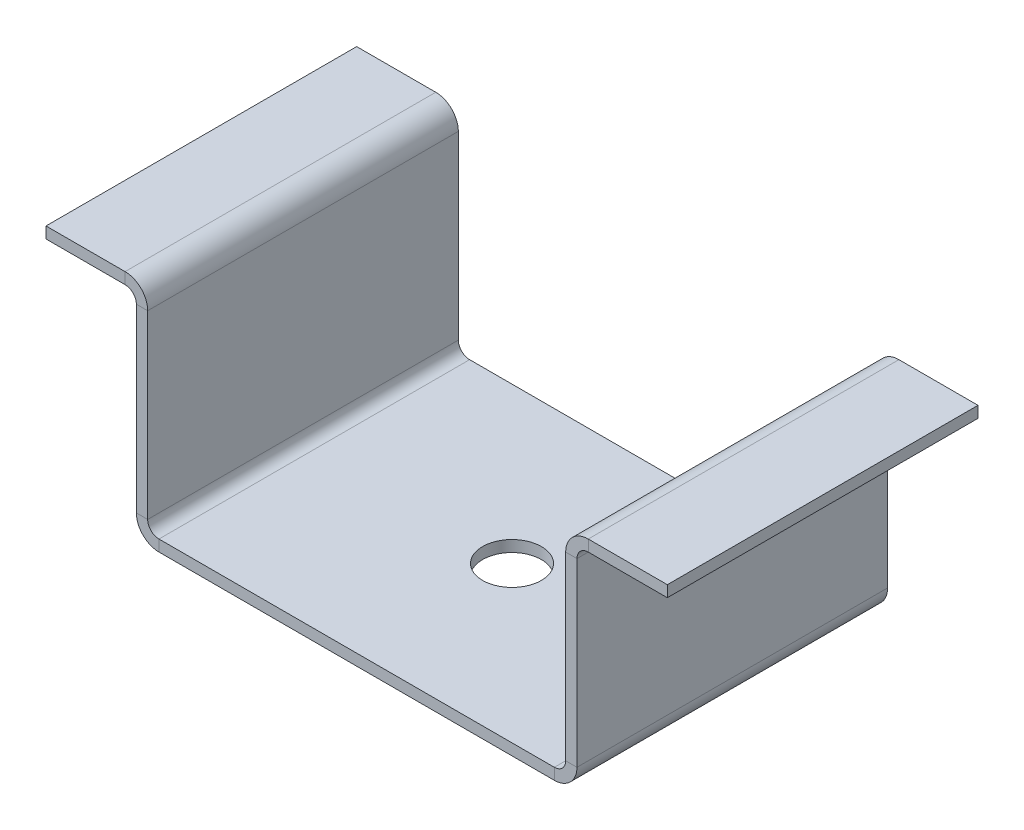
from build123d import *

# Parameters (mm, degrees)
SKETCH1_W                      = 78
SKETCH1_H                      = 2
BASE_FLANGE1_DEPTH             = 27.5
EDGE_FLANGE1_STRIP_W           = 12
EDGE_FLANGE1_STRIP_H           = 2
EDGE_FLANGE1_STRIP_CUT_DEPTH   = 55
EDGE_FLANGE1_STRIP_2_W         = 12
EDGE_FLANGE1_STRIP_2_H         = 2
EDGE_FLANGE1_STRIP_CUT_2_DEPTH = 55
EDGE_FLANGE1_DEPTH             = 55
EDGE_FLANGE1_BEND_DEPTH        = 55
EDGE_FLANGE2_STRIP_W           = 12
EDGE_FLANGE2_STRIP_H           = 2
EDGE_FLANGE2_STRIP_CUT_DEPTH   = 55
EDGE_FLANGE2_STRIP_2_W         = 12
EDGE_FLANGE2_STRIP_2_H         = 2
EDGE_FLANGE2_STRIP_CUT_2_DEPTH = 55
EDGE_FLANGE2_DEPTH             = 55
EDGE_FLANGE2_BEND_DEPTH        = 55
SKETCH18_R                     = 5.2
CUT_EXTRUDE1_DEPTH             = 10


# Sheet-metal steps are written as plain solids
with BuildPart() as part:
    # Sketch1 → Base-Flange1 (new, symmetric)
    with BuildSketch(Plane.XY):
        with Locations((0, 1)):
            Rectangle(SKETCH1_W, SKETCH1_H)
    extrude(amount=BASE_FLANGE1_DEPTH, both=True)

    # Edge-Flange1 strip (across the edge) → Edge-Flange1 strip cut (cut)
    with BuildSketch(Plane(origin=(-39, 2, -27.5), x_dir=(1, 0, 0), z_dir=(0, 0, 1))):
        with Locations((-2, -1)):
            Rectangle(EDGE_FLANGE1_STRIP_W, EDGE_FLANGE1_STRIP_H)
    extrude(amount=EDGE_FLANGE1_STRIP_CUT_DEPTH, mode=Mode.SUBTRACT)

    # Edge-Flange1 strip 2 (across the edge) → Edge-Flange1 strip cut 2 (cut)
    with BuildSketch(Plane(origin=(39, 2, 27.5), x_dir=(-1, 0, 0), z_dir=(0, 0, -1))):
        with Locations((-2, -1)):
            Rectangle(EDGE_FLANGE1_STRIP_2_W, EDGE_FLANGE1_STRIP_2_H)
    extrude(amount=EDGE_FLANGE1_STRIP_CUT_2_DEPTH, mode=Mode.SUBTRACT)

    # Edge-Flange1 section (across the edge) → Edge-Flange1 (add)
    with BuildSketch(Plane(origin=(-39, 2, -27.5), x_dir=(1, 0, 0), z_dir=(0, 0, 1))):
        with BuildLine():
            Line((0, 2), (0, 38))
            Line((0, 38), (2, 38))
            Line((2, 38), (2, 2))
            ThreePointArc((2, 2), (2.585786438, 0.585786438), (4, 0))
            Line((4, 0), (4, -2))
            ThreePointArc((4, -2), (1.171572875, -0.828427125), (0, 2))
        make_face()
    extrude(amount=EDGE_FLANGE1_DEPTH)

    # Edge-Flange1 section 2 (across the edge) → Edge-Flange1 bend (add)
    with BuildSketch(Plane(origin=(39, 2, 27.5), x_dir=(-1, 0, 0), z_dir=(0, 0, -1))):
        with BuildLine():
            Line((0, 2), (0, 38))
            Line((0, 38), (2, 38))
            Line((2, 38), (2, 2))
            ThreePointArc((2, 2), (2.585786438, 0.585786438), (4, 0))
            Line((4, 0), (4, -2))
            ThreePointArc((4, -2), (1.171572875, -0.828427125), (0, 2))
        make_face()
    extrude(amount=EDGE_FLANGE1_BEND_DEPTH)

    # Edge-Flange2 strip (across the edge) → Edge-Flange2 strip cut (cut)
    with BuildSketch(Plane(origin=(39, 40, -27.5), x_dir=(0, -1, 0), z_dir=(0, 0, 1))):
        with Locations((-2, -1)):
            Rectangle(EDGE_FLANGE2_STRIP_W, EDGE_FLANGE2_STRIP_H)
    extrude(amount=EDGE_FLANGE2_STRIP_CUT_DEPTH, mode=Mode.SUBTRACT)

    # Edge-Flange2 strip 2 (across the edge) → Edge-Flange2 strip cut 2 (cut)
    with BuildSketch(Plane(origin=(-39, 40, 27.5), x_dir=(0, -1, 0), z_dir=(0, 0, -1))):
        with Locations((-2, -1)):
            Rectangle(EDGE_FLANGE2_STRIP_2_W, EDGE_FLANGE2_STRIP_2_H)
    extrude(amount=EDGE_FLANGE2_STRIP_CUT_2_DEPTH, mode=Mode.SUBTRACT)

    # Edge-Flange2 section (across the edge) → Edge-Flange2 (add)
    with BuildSketch(Plane(origin=(39, 40, -27.5), x_dir=(0, -1, 0), z_dir=(0, 0, 1))):
        with BuildLine():
            Line((0, 2), (0, 16))
            Line((0, 16), (2, 16))
            Line((2, 16), (2, 2))
            ThreePointArc((2, 2), (2.585786438, 0.585786438), (4, 0))
            Line((4, 0), (4, -2))
            ThreePointArc((4, -2), (1.171572875, -0.828427125), (0, 2))
        make_face()
    extrude(amount=EDGE_FLANGE2_DEPTH)

    # Edge-Flange2 section 2 (across the edge) → Edge-Flange2 bend (add)
    with BuildSketch(Plane(origin=(-39, 40, 27.5), x_dir=(0, -1, 0), z_dir=(0, 0, -1))):
        with BuildLine():
            Line((0, 2), (0, 16))
            Line((0, 16), (2, 16))
            Line((2, 16), (2, 2))
            ThreePointArc((2, 2), (2.585786438, 0.585786438), (4, 0))
            Line((4, 0), (4, -2))
            ThreePointArc((4, -2), (1.171572875, -0.828427125), (0, 2))
        make_face()
    extrude(amount=EDGE_FLANGE2_BEND_DEPTH)

    # Sketch18 → Cut-Extrude1 (cut)
    with BuildSketch(Plane(origin=(0, 2, 0), x_dir=(1, 0, 0), z_dir=(0, 1, 0))):
        with Locations(Location((0, 0, 0), (0, 0, 270))):
            Circle(SKETCH18_R)
    extrude(amount=-CUT_EXTRUDE1_DEPTH, mode=Mode.SUBTRACT)


solid = part.part
